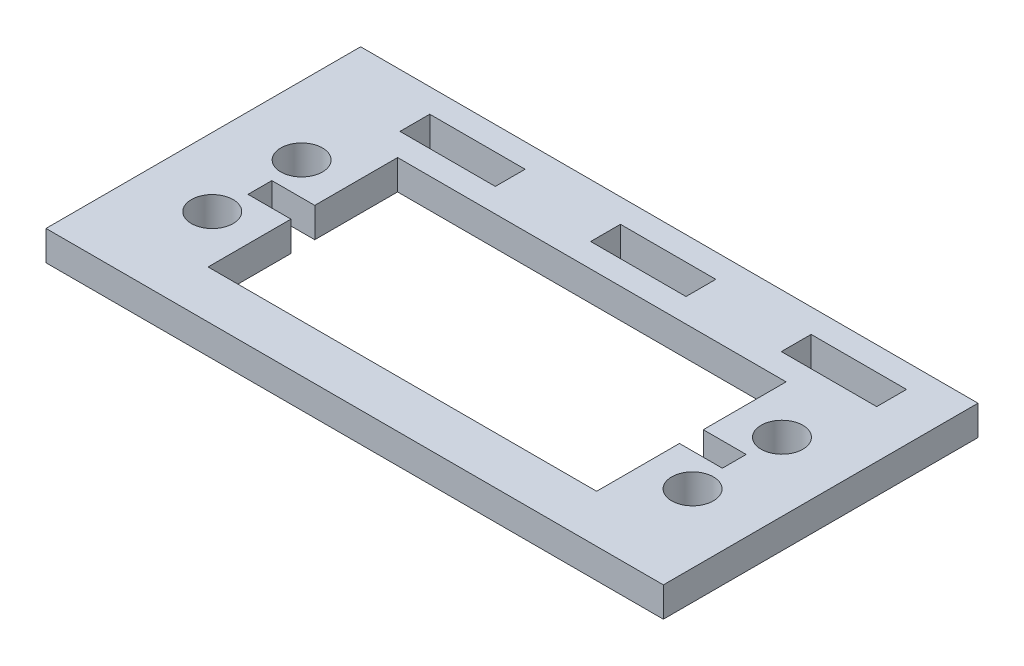
from build123d import *

# Parameters (mm, degrees)
SKETCH1_W           = 65.786
SKETCH1_H           = 33.528
SKETCH1_R           = 2.2225
SKETCH1_W_2         = 10.16
SKETCH1_H_2         = 3.175
BOSS_EXTRUDE2_DEPTH = 3.175


with BuildPart() as part:
    # Sketch1 → Boss-Extrude2 (new body)
    with BuildSketch(Plane(origin=(0, 0, 0), x_dir=(1, 0, 0), z_dir=(0, 1, 0))):
        with Locations((0, 1.5875)):
            Rectangle(SKETCH1_W, SKETCH1_H)
        with Locations((-25.5905, -4.7625)):
            Circle(SKETCH1_R, mode=Mode.SUBTRACT)
        Polygon((20.701, -10.0965), (-20.701, -10.0965), (-20.701, -1.27), (-25.273, -1.27), (-25.273, 1.27), (-20.701, 1.27), (-20.701, 10.0965), (20.701, 10.0965), (20.701, 1.27), (25.273, 1.27), (25.273, -1.27), (20.701, -1.27), align=None, mode=Mode.SUBTRACT)
        with Locations((25.5905, -4.7625)):
            Circle(SKETCH1_R, mode=Mode.SUBTRACT)
        with Locations((-25.5905, 4.7625)):
            Circle(SKETCH1_R, mode=Mode.SUBTRACT)
        with Locations((-17.907, 14.224)):
            Rectangle(SKETCH1_W_2, SKETCH1_H_2, mode=Mode.SUBTRACT)
        with Locations((25.5905, 4.7625)):
            Circle(SKETCH1_R, mode=Mode.SUBTRACT)
        with Locations((2.413, 14.224)):
            Rectangle(SKETCH1_W_2, SKETCH1_H_2, mode=Mode.SUBTRACT)
        with Locations((22.733, 14.224)):
            Rectangle(SKETCH1_W_2, SKETCH1_H_2, mode=Mode.SUBTRACT)
    extrude(amount=BOSS_EXTRUDE2_DEPTH)


solid = part.part
